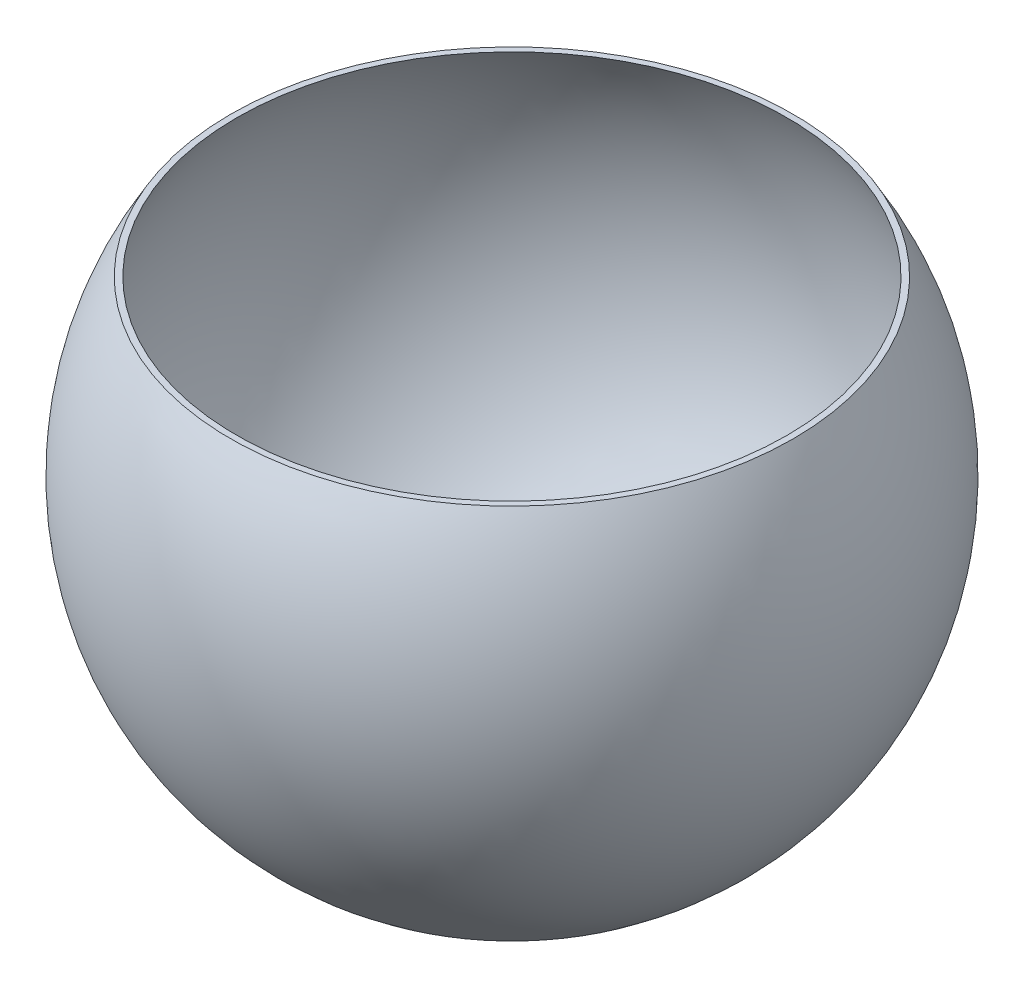
from build123d import *


with BuildPart() as part:
    # Sketch1 → Revolve1 (revolve)
    with BuildSketch(Plane.XY):
        with BuildLine():
            Line((173.362154908, 178.868849687), (169.62958875, 178.868849687))
            ThreePointArc((169.62958875, 178.868849687), (174.94637033, -24.103250087), (0, -127.155222222))
            Line((0, -127.155222222), (0, -130.330222222))
            ThreePointArc((0, -130.330222222), (177.241715479, -26.506347595), (173.362154908, 178.868849687))
        make_face()
    revolve(axis=Axis((0, 0, 0), (0, -1, 0)))


solid = part.part
